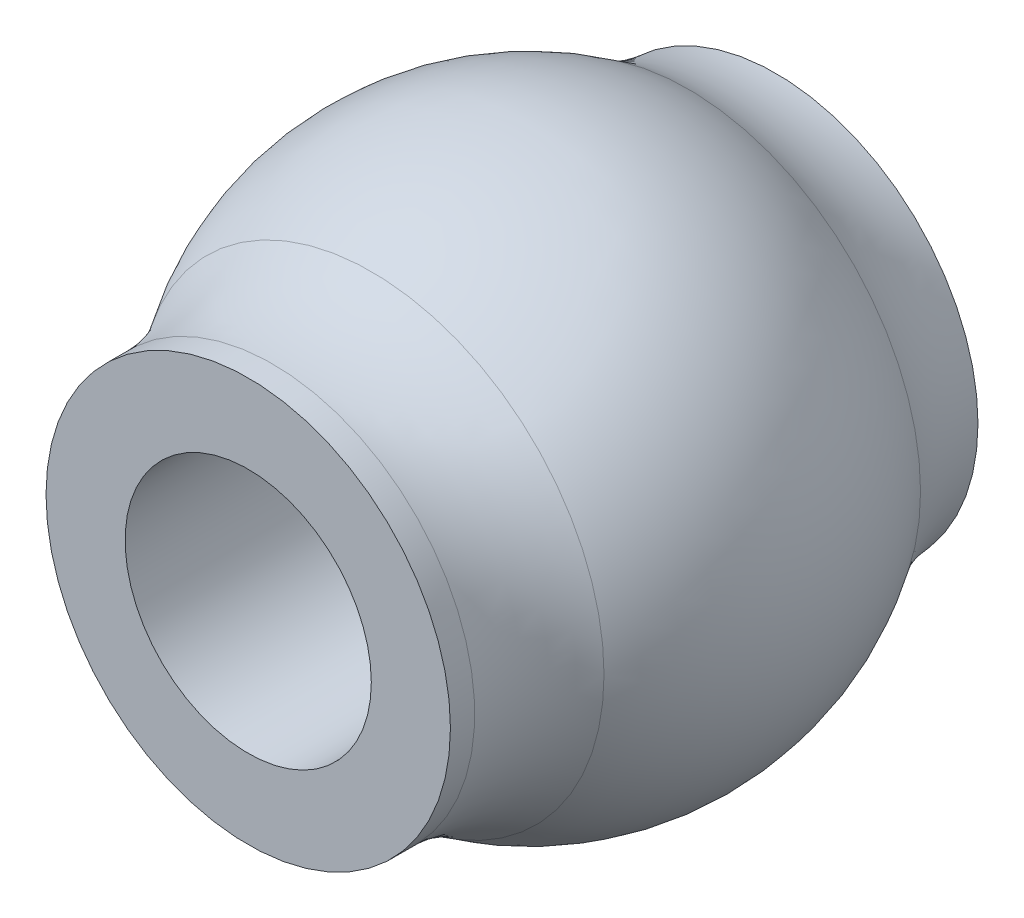
from build123d import *

# Parameters (mm, degrees)
SKETCH2_R           = 2.875
BOSS_EXTRUDE1_DEPTH = 0.71892557
BOSS_EXTRUDE2_START = 1.218925567
SKETCH3_R           = 2.875
BOSS_EXTRUDE2_DEPTH = 1.218925567
SKETCH4_R           = 1.75
CUT_EXTRUDE1_DEPTH  = 14.12440475
FILLET1_R           = 2.5


with BuildPart() as part:
    # Sketch1 → Revolve1 (revolve)
    with BuildSketch(Plane(origin=(0, 0, 0), x_dir=(1, 0, 0), z_dir=(0, 1, 0))):
        with BuildLine():
            Line((8.875, 0.281074433), (6, 0.281074433))
            Line((6, 0.281074433), (6, -5.281074433))
            Line((6, -5.281074433), (8.875, -5.281074433))
            ThreePointArc((8.875, -5.281074433), (10, -2.5), (8.875, 0.281074433))
        make_face()
    revolve(axis=Axis((6, 0, -0.281074433), (0, 0, 1)))

    # Sketch2 → Boss-Extrude1 (add)
    with BuildSketch(Plane(origin=(0, 0, -0.281074433), x_dir=(-1, 0, 0), z_dir=(0, 0, -1))):
        with Locations(Location((-6, 0, 0), (0, 0, 180))):
            Circle(SKETCH2_R)
    extrude(amount=BOSS_EXTRUDE1_DEPTH)

    # Sketch3 → Boss-Extrude2 (add)
    with BuildSketch(Plane.XY.offset(5.281074433).offset(BOSS_EXTRUDE2_START)):
        with Locations((6, 0)):
            Circle(SKETCH3_R)
    extrude(amount=-BOSS_EXTRUDE2_DEPTH)

    # Sketch4 → Cut-Extrude1 (cut, through all)
    with BuildSketch(Plane(origin=(0, 0, -1.000000003), x_dir=(-1, 0, 0), z_dir=(0, 0, -1))):
        with Locations(Location((-6, 0, 0), (0, 0, 180))):
            Circle(SKETCH4_R)
    extrude(amount=-CUT_EXTRUDE1_DEPTH, mode=Mode.SUBTRACT)

    # Fillet1
    # the kernel refuses this fillet: 2.5 mm, written as the material it adds along each edge
    with BuildSketch(Plane(origin=(6, 0, 5.281074433), x_dir=(1, 0, 0), z_dir=(0, -1, 0))) as fillet1_piece_1:
        with BuildLine():
            CenterArc((5.375, 0.873973447), FILLET1_R, 180, 34.216051131)
            Line((2.875, 0.873973447), (2.825, 0.873973447))
            Line((2.825, 0.873973447), (2.825, 0))
            Line((2.825, 0), (2.8390625, -0.03476343))
            ThreePointArc((2.8390625, -0.03476343), (3.063976775, -0.288175252), (3.266346154, -0.559929952))
            Line((3.266346154, -0.559929952), (3.307692308, -0.531814199))
        make_face()
    revolve(axis=Axis((6, 0, 5.281074433), (0, 0, 1)))
    with BuildSketch(Plane(origin=(6, 0, -0.281074433), x_dir=(1, 0, 0), z_dir=(0, -1, 0))) as fillet1_piece_2:
        with BuildLine():
            CenterArc((5.369690775, -0.881768859), FILLET1_R, 145.700811221, 30.56445132)
            Line((2.875, -0.71892557), (2.825106184, -0.715668704))
            ThreePointArc((2.825106184, -0.715668704), (2.825, -0.359462785), (2.825, 0))
            Line((2.825, 0), (2.8390625, 0.03476343))
            ThreePointArc((2.8390625, 0.03476343), (3.062167338, 0.285952954), (3.263119779, 0.55519274))
            Line((3.263119779, 0.55519274), (3.304425092, 0.527017022))
        make_face()
    revolve(axis=Axis((6, 0, -0.281074433), (0, 0, 1)))


solid = part.part
